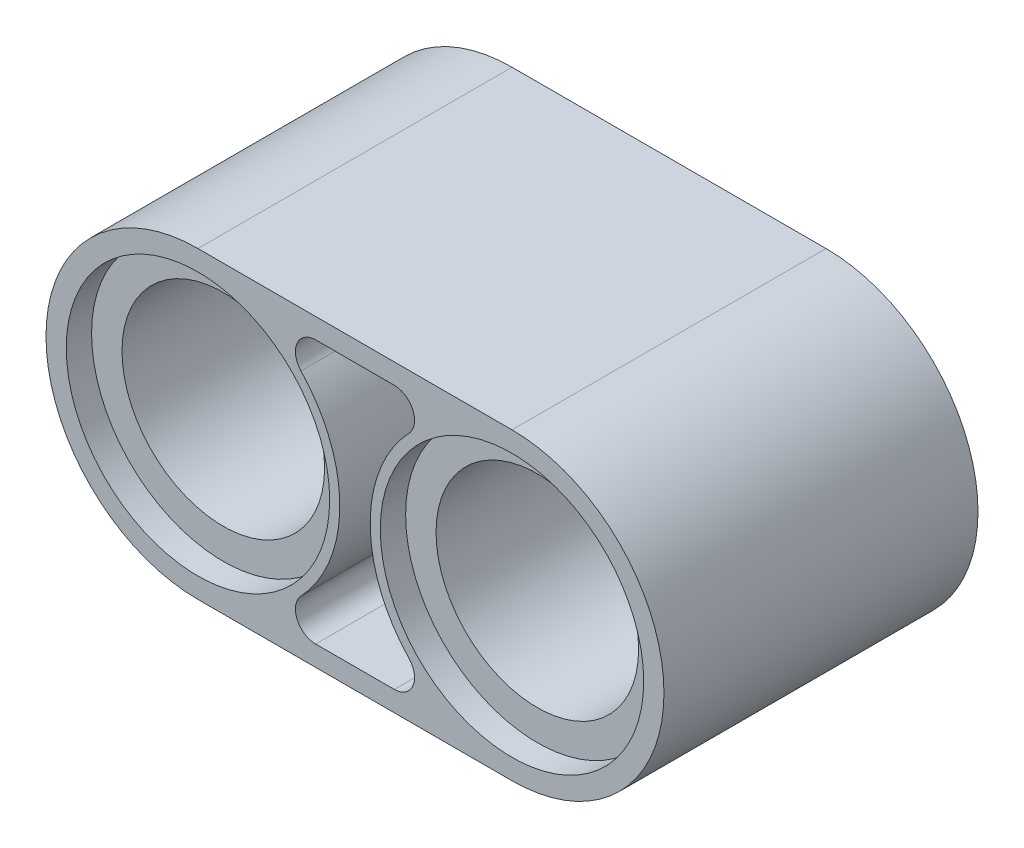
from build123d import *

# Parameters (mm, degrees)
SKETCH1_R                   = 3.302
SKETCH1_R_2                 = 2.54
BOSS_EXTRUDE1_DEPTH         = 3.937
BODY_MOVE_COPY1_OUTLINE_R   = 2.54
BODY_MOVE_COPY1_DEPTH       = 3.937
BODY_MOVE_COPY1_2_OUTLINE_R = 2.54
BODY_MOVE_COPY1_2_DEPTH     = 3.937
SKETCH2_R                   = 3.302
CUT_EXTRUDE1_DEPTH          = 0.635


# Read off the part's stored shape, not the designer's step: Body-Move/Copy1
with BuildPart() as part:
    # Sketch1 → Boss-Extrude1 (new body)
    # profile 1 of 4: a face of its own
    with BuildSketch(Plane.XY):
        with BuildLine():
            Line((3.937, -3.81), (7.874, -3.81))
            ThreePointArc((7.874, -3.81), (11.684, 0), (7.874, 3.81))
            Line((7.874, 3.81), (3.937, 3.81))
            Line((3.937, 3.81), (3.937, 3.302))
            Line((3.937, 3.302), (4.92278669, 3.302))
            ThreePointArc((4.92278669, 3.302), (5.389414486, 2.994804631), (5.291688354, 2.44475))
            ThreePointArc((5.291688354, 2.44475), (4.318, 0), (5.291688354, -2.44475))
            ThreePointArc((5.291688354, -2.44475), (5.389414486, -2.994804631), (4.92278669, -3.302))
            Line((4.92278669, -3.302), (3.937, -3.302))
            Line((3.937, -3.302), (3.937, -3.81))
        make_face()
        with Locations((7.874, 0)):
            Circle(SKETCH1_R, mode=Mode.SUBTRACT)
    # profile 2 of 4: a face of its own
    with BuildSketch(Plane.XY):
        with Locations((7.874, 0)):
            Circle(SKETCH1_R)
        with Locations((7.874, 0)):
            Circle(SKETCH1_R_2, mode=Mode.SUBTRACT)
    # profile 3 of 4: a face of its own
    with BuildSketch(Plane.XY):
        with BuildLine():
            Line((-7.874, -3.81), (-3.937, -3.81))
            Line((-3.937, -3.81), (-3.937, -3.302))
            Line((-3.937, -3.302), (-4.92278669, -3.302))
            ThreePointArc((-4.92278669, -3.302), (-5.389414486, -2.994804631), (-5.291688354, -2.44475))
            ThreePointArc((-5.291688354, -2.44475), (-4.318, 0), (-5.291688354, 2.44475))
            ThreePointArc((-5.291688354, 2.44475), (-5.389414486, 2.994804631), (-4.92278669, 3.302))
            Line((-4.92278669, 3.302), (-3.937, 3.302))
            Line((-3.937, 3.302), (-3.937, 3.81))
            Line((-3.937, 3.81), (-7.874, 3.81))
            ThreePointArc((-7.874, 3.81), (-11.684, 0), (-7.874, -3.81))
        make_face()
        with Locations((-7.874, 0)):
            Circle(SKETCH1_R, mode=Mode.SUBTRACT)
    # profile 4 of 4: a face of its own
    with BuildSketch(Plane.XY):
        with Locations((-7.874, 0)):
            Circle(SKETCH1_R)
        with Locations((-7.874, 0)):
            Circle(SKETCH1_R_2, mode=Mode.SUBTRACT)
    extrude(amount=BOSS_EXTRUDE1_DEPTH)

    # Body-Move/Copy1 outline → Body-Move/Copy1 (cut)
    with BuildSketch(Plane.XY):
        with BuildLine():
            ThreePointArc((-7.874, 3.81), (-11.684, 0), (-7.874, -3.81))
            Line((-7.874, -3.81), (-3.937, -3.81))
            Line((-3.937, -3.81), (-3.937, -3.302))
            Line((-3.937, -3.302), (-4.92278669, -3.302))
            ThreePointArc((-4.92278669, -3.302), (-5.389414486, -2.994804631), (-5.291688354, -2.44475))
            ThreePointArc((-5.291688354, -2.44475), (-4.318, 0), (-5.291688354, 2.44475))
            ThreePointArc((-5.291688354, 2.44475), (-5.389414486, 2.994804631), (-4.92278669, 3.302))
            Line((-4.92278669, 3.302), (-3.937, 3.302))
            Line((-3.937, 3.302), (-3.937, 3.81))
            Line((-3.937, 3.81), (-7.874, 3.81))
        make_face()
        with Locations((-7.874, 0)):
            Circle(BODY_MOVE_COPY1_OUTLINE_R, mode=Mode.SUBTRACT)
    extrude(amount=BODY_MOVE_COPY1_DEPTH, mode=Mode.SUBTRACT)


with BuildPart() as body_2:
    # Body-Move_Copy1 2 outline → Body-Move_Copy1 2 (new body)
    with BuildSketch(Plane.XY):
        with BuildLine():
            ThreePointArc((0, 3.81), (-3.81, 0), (0, -3.81))
            Line((0, -3.81), (3.937, -3.81))
            Line((3.937, -3.81), (3.937, -3.302))
            Line((3.937, -3.302), (2.95121331, -3.302))
            ThreePointArc((2.95121331, -3.302), (2.484585514, -2.994804631), (2.582311646, -2.44475))
            ThreePointArc((2.582311646, -2.44475), (3.556, 0), (2.582311646, 2.44475))
            ThreePointArc((2.582311646, 2.44475), (2.484585514, 2.994804631), (2.95121331, 3.302))
            Line((2.95121331, 3.302), (3.937, 3.302))
            Line((3.937, 3.302), (3.937, 3.81))
            Line((3.937, 3.81), (0, 3.81))
        make_face()
        Circle(BODY_MOVE_COPY1_2_OUTLINE_R, mode=Mode.SUBTRACT)
    extrude(amount=BODY_MOVE_COPY1_2_DEPTH)


with BuildPart() as cut_extrude1_tool:
    # Sketch2 → Cut-Extrude1 (new body)
    with BuildSketch(Plane.XY):
        with Locations((7.874, 0)):
            Circle(SKETCH2_R)
        Circle(SKETCH2_R)
    extrude(amount=CUT_EXTRUDE1_DEPTH)


with BuildPart() as part_1:
    add(part.part)

    # Cut-Extrude1: cut by cut_extrude1_tool
    add(cut_extrude1_tool.part, mode=Mode.SUBTRACT)


with BuildPart() as body_2_1:
    add(body_2.part)

    # Cut-Extrude1: cut by cut_extrude1_tool
    add(cut_extrude1_tool.part, mode=Mode.SUBTRACT)


with BuildPart() as part_2:
    add(part_1.part)

    # Combine1: union body 2
    add(body_2_1.part)

    # Mirror3: part across plane


with BuildPart() as part_3:
    add(part_2.part)
    add(part_2.part.mirror(Plane.XY.offset(3.937)))


solid = part_3.part
